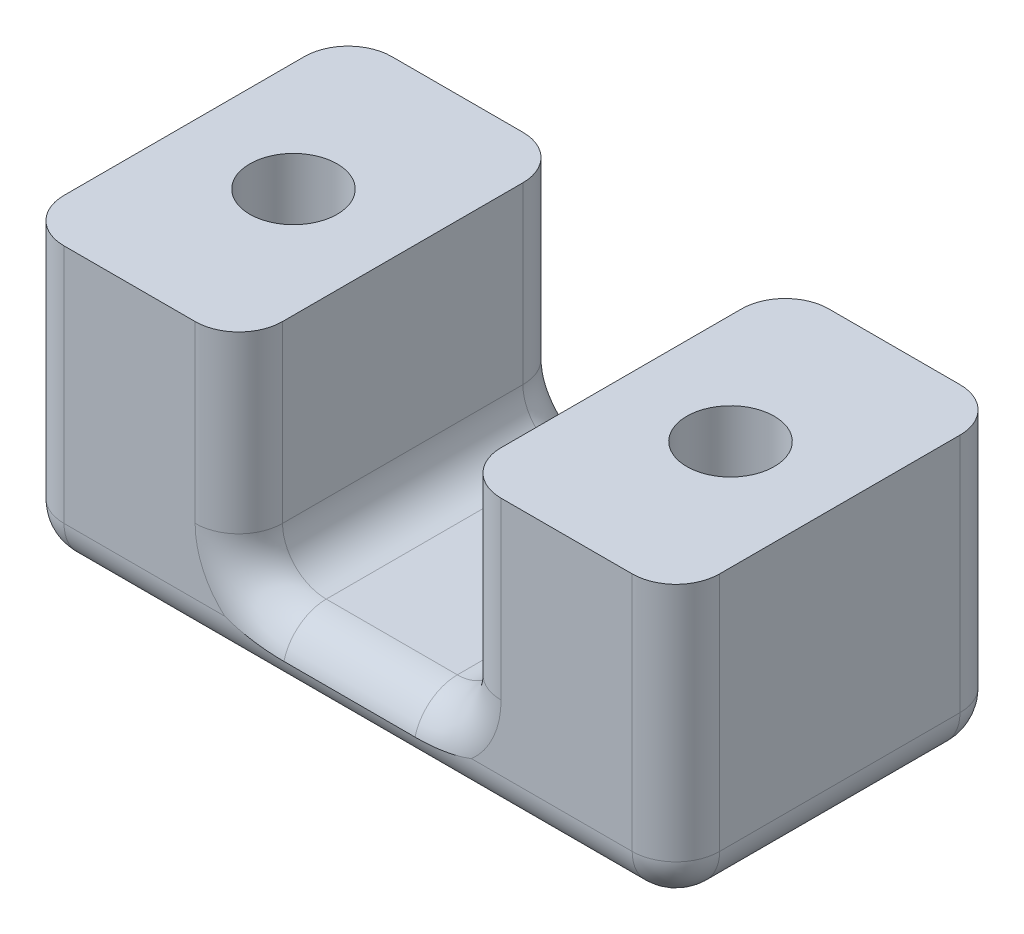
from build123d import *

# Parameters (mm, degrees)
SKETCH1_W           = 30
SKETCH1_H           = 15
BOSS_EXTRUDE1_DEPTH = 3
SKETCH2_W           = 10
SKETCH2_H           = 15
BOSS_EXTRUDE2_DEPTH = 10
SKETCH3_R           = 2
CUT_EXTRUDE1_DEPTH  = 30
FILLET1_R           = 2


with BuildPart() as part:
    # Sketch1 → Boss-Extrude1 (new body)
    with BuildSketch(Plane(origin=(0, 0, 0), x_dir=(1, 0, 0), z_dir=(0, 1, 0))):
        with Locations((15, 7.5)):
            Rectangle(SKETCH1_W, SKETCH1_H)
    extrude(amount=BOSS_EXTRUDE1_DEPTH)

    # Sketch2 → Boss-Extrude2 (add)
    with BuildSketch(Plane(origin=(0, 3, 0), x_dir=(1, 0, 0), z_dir=(0, 1, 0))):
        with Locations((5, 7.5)):
            Rectangle(SKETCH2_W, SKETCH2_H)
        with Locations((25, 7.5)):
            Rectangle(SKETCH2_W, SKETCH2_H)
    extrude(amount=BOSS_EXTRUDE2_DEPTH)

    # Sketch3 → Cut-Extrude1 (cut)
    with BuildSketch(Plane.XZ):
        with Locations(Location((5, -7.5, 0), (0, 0, 270))):
            Circle(SKETCH3_R)
        with Locations(Location((25, -7.5, 0), (0, 0, 270))):
            Circle(SKETCH3_R)
    extrude(amount=-CUT_EXTRUDE1_DEPTH, mode=Mode.SUBTRACT)

    # Fillet1
    # the kernel refuses this fillet: 2 mm, written as the material it adds along each edge
    with BuildSketch(Plane(origin=(10, 3, -15), x_dir=(0, 1, 0), z_dir=(0, 0, 1)), Plane(origin=(20, 3, -15), x_dir=(-1, 0, 0), z_dir=(0, 0, 1))) as fillet1_piece_1:
        with BuildLine():
            CenterArc((FILLET1_R, -FILLET1_R), FILLET1_R, 90, 90)
            Line((0, -FILLET1_R), (0, 0))
            Line((0, 0), (FILLET1_R, 0))
        make_face()
    extrude(amount=15)
    # the kernel refuses this fillet: 2 mm, written as the material it takes off along each edge
    with BuildSketch(Plane(origin=(28, 2, -13), x_dir=(0, 0, -1), z_dir=(0, -1, 0))) as fillet1_2_piece_1_section:
        Polygon((0, 0), (FILLET1_R, 0), (FILLET1_R, FILLET1_R), (0, FILLET1_R), align=None)
    fillet1_2_piece_1 = extrude(amount=FILLET1_R, mode=Mode.PRIVATE)
    fillet1_2_piece_1 = fillet1_2_piece_1 - Plane(origin=(28, 2, -13), x_dir=(-0.7071067811865475, 0, 0.7071067811865475), z_dir=(0, -1, 0)) * Sphere(FILLET1_R, mode=Mode.PRIVATE)
    add(fillet1_2_piece_1, mode=Mode.SUBTRACT)
    with BuildSketch(Plane(origin=(2, 2, -13), x_dir=(0, 0, -1), z_dir=(0, -1, 0))) as fillet1_2_piece_2_section:
        Polygon((0, 0), (FILLET1_R, 0), (FILLET1_R, -FILLET1_R), (0, -FILLET1_R), align=None)
    fillet1_2_piece_2 = extrude(amount=FILLET1_R, mode=Mode.PRIVATE)
    fillet1_2_piece_2 = fillet1_2_piece_2 - Plane(origin=(2, 2, -13), x_dir=(0.7071067811865475, 0, 0.7071067811865475), z_dir=(0, -1, 0)) * Sphere(FILLET1_R, mode=Mode.PRIVATE)
    add(fillet1_2_piece_2, mode=Mode.SUBTRACT)
    with BuildSketch(Plane(origin=(28, 2, -2), x_dir=(0, 0, 1), z_dir=(0, -1, 0))) as fillet1_2_piece_3_section:
        Polygon((0, 0), (FILLET1_R, 0), (FILLET1_R, -FILLET1_R), (0, -FILLET1_R), align=None)
    fillet1_2_piece_3 = extrude(amount=FILLET1_R, mode=Mode.PRIVATE)
    fillet1_2_piece_3 = fillet1_2_piece_3 - Plane(origin=(28, 2, -2), x_dir=(-0.7071067811865475, 0, -0.7071067811865475), z_dir=(0, -1, 0)) * Sphere(FILLET1_R, mode=Mode.PRIVATE)
    add(fillet1_2_piece_3, mode=Mode.SUBTRACT)
    with BuildSketch(Plane(origin=(2, 2, -2), x_dir=(0, -1, 0), z_dir=(0, 0, 1))) as fillet1_2_piece_4_section:
        Polygon((0, 0), (FILLET1_R, 0), (FILLET1_R, -FILLET1_R), (0, -FILLET1_R), align=None)
    fillet1_2_piece_4 = extrude(amount=FILLET1_R, mode=Mode.PRIVATE)
    fillet1_2_piece_4 = fillet1_2_piece_4 - Plane(origin=(2, 2, -2), x_dir=(0.7071067811865475, 0.7071067811865475, 0), z_dir=(0, 0, 1)) * Sphere(FILLET1_R, mode=Mode.PRIVATE)
    add(fillet1_2_piece_4, mode=Mode.SUBTRACT)
    with BuildSketch(Plane(origin=(28, 0, -15), x_dir=(0, 0, 1), z_dir=(-1, 0, 0))) as fillet1_2_piece_5:
        with BuildLine():
            CenterArc((FILLET1_R, FILLET1_R), FILLET1_R, 180, 90)
            Line((0, FILLET1_R), (0, 0))
            Line((0, 0), (FILLET1_R, 0))
        make_face()
    extrude(amount=26, mode=Mode.SUBTRACT)
    with BuildSketch(Plane(origin=(30, 0, -2), x_dir=(0, 1, 0), z_dir=(0, 0, -1)), Plane(origin=(0, 0, -13), x_dir=(0, 1, 0), z_dir=(0, 0, 1))) as fillet1_2_piece_6:
        with BuildLine():
            CenterArc((FILLET1_R, -FILLET1_R), FILLET1_R, 90, 90)
            Line((0, -FILLET1_R), (0, 0))
            Line((0, 0), (FILLET1_R, 0))
        make_face()
    extrude(amount=11, mode=Mode.SUBTRACT)
    with BuildSketch(Plane(origin=(2, 0, 0), x_dir=(0, 1, 0), z_dir=(1, 0, 0))) as fillet1_2_piece_7:
        with BuildLine():
            CenterArc((FILLET1_R, -FILLET1_R), FILLET1_R, 90, 90)
            Line((0, -FILLET1_R), (0, 0))
            Line((0, 0), (FILLET1_R, 0))
        make_face()
    extrude(amount=26, mode=Mode.SUBTRACT)
    with BuildSketch(Plane(origin=(0, 18, -15), x_dir=(0, 0, 1), z_dir=(0, -1, 0)), Plane(origin=(30, 2, -15), x_dir=(0, 0, 1), z_dir=(0, 1, 0)), Plane(origin=(30, 2, 0), x_dir=(-1, 0, 0), z_dir=(0, 1, 0)), Plane(origin=(0, 18, 0), x_dir=(1, 0, 0), z_dir=(0, -1, 0))) as fillet1_2_piece_8:
        with BuildLine():
            CenterArc((FILLET1_R, -FILLET1_R), FILLET1_R, 90, 90)
            Line((0, -FILLET1_R), (0, 0))
            Line((0, 0), (FILLET1_R, 0))
        make_face()
    extrude(amount=16, mode=Mode.SUBTRACT)
    # the kernel refuses this fillet: 2 mm, written as the material it takes off along each edge
    with BuildSketch(Plane(origin=(12, 3, 0), x_dir=(0, -1, 0), z_dir=(1, 0, 0))) as fillet1_3_piece_1:
        with BuildLine():
            CenterArc((FILLET1_R, FILLET1_R), FILLET1_R, 180, 90)
            Line((0, FILLET1_R), (0, 0))
            Line((0, 0), (FILLET1_R, 0))
        make_face()
    extrude(amount=6, mode=Mode.SUBTRACT)
    with BuildSketch(Plane(origin=(10, 5, 0), x_dir=(-1, 0, 0), z_dir=(0, 1, 0)), Plane(origin=(10, 5, -15), x_dir=(0, 0, 1), z_dir=(0, 1, 0))) as fillet1_3_piece_2:
        with BuildLine():
            CenterArc((FILLET1_R, -FILLET1_R), FILLET1_R, 90, 90)
            Line((0, -FILLET1_R), (0, 0))
            Line((0, 0), (FILLET1_R, 0))
        make_face()
    extrude(amount=13, mode=Mode.SUBTRACT)
    with BuildSketch(Plane(origin=(18, 3, -15), x_dir=(0, 0, 1), z_dir=(-1, 0, 0))) as fillet1_3_piece_3:
        with BuildLine():
            CenterArc((FILLET1_R, -FILLET1_R), FILLET1_R, 90, 90)
            Line((0, -FILLET1_R), (0, 0))
            Line((0, 0), (FILLET1_R, 0))
        make_face()
    extrude(amount=6, mode=Mode.SUBTRACT)
    with BuildSketch(Plane(origin=(20, 5, -15), x_dir=(0, 0, 1), z_dir=(0, 1, 0)), Plane(origin=(20, 5, 0), x_dir=(1, 0, 0), z_dir=(0, 1, 0))) as fillet1_3_piece_4:
        with BuildLine():
            CenterArc((FILLET1_R, FILLET1_R), FILLET1_R, 180, 90)
            Line((0, FILLET1_R), (0, 0))
            Line((0, 0), (FILLET1_R, 0))
        make_face()
    extrude(amount=13, mode=Mode.SUBTRACT)
    with BuildSketch(Plane(origin=(18, 5, 0), x_dir=(0, -1, 0), z_dir=(-1, 0, 0))) as fillet1_3_piece_5:
        with BuildLine():
            CenterArc((2 + FILLET1_R, -FILLET1_R), FILLET1_R, 90, 90)
            Line((2, -FILLET1_R), (2, 0))
            Line((2, 0), (2 + FILLET1_R, 0))
        make_face()
    revolve(axis=Axis((18, 5, 0), (0, 0, 1)), revolution_arc=90, mode=Mode.SUBTRACT)
    with BuildSketch(Plane(origin=(18, 5, -15), x_dir=(0, -1, 0), z_dir=(-1, 0, 0))) as fillet1_3_piece_6:
        with BuildLine():
            CenterArc((2 + FILLET1_R, FILLET1_R), FILLET1_R, 180, 90)
            Line((2 + FILLET1_R, 0), (2, 0))
            Line((2, 0), (2, FILLET1_R))
        make_face()
    revolve(axis=Axis((18, 5, -15), (0, 0, 1)), revolution_arc=90, mode=Mode.SUBTRACT)
    with BuildSketch(Plane(origin=(12, 5, -15), x_dir=(-1, 0, 0), z_dir=(0, 1, 0))) as fillet1_3_piece_7:
        with BuildLine():
            CenterArc((2 + FILLET1_R, FILLET1_R), FILLET1_R, 180, 90)
            Line((2 + FILLET1_R, 0), (2, 0))
            Line((2, 0), (2, FILLET1_R))
        make_face()
    revolve(axis=Axis((12, 5, -15), (0, 0, 1)), revolution_arc=90, mode=Mode.SUBTRACT)
    with BuildSketch(Plane(origin=(12, 5, 0), x_dir=(-1, 0, 0), z_dir=(0, 1, 0))) as fillet1_3_piece_8:
        with BuildLine():
            CenterArc((2 + FILLET1_R, -FILLET1_R), FILLET1_R, 90, 90)
            Line((2, -FILLET1_R), (2, 0))
            Line((2, 0), (2 + FILLET1_R, 0))
        make_face()
    revolve(axis=Axis((12, 5, 0), (0, 0, 1)), revolution_arc=90, mode=Mode.SUBTRACT)


solid = part.part
